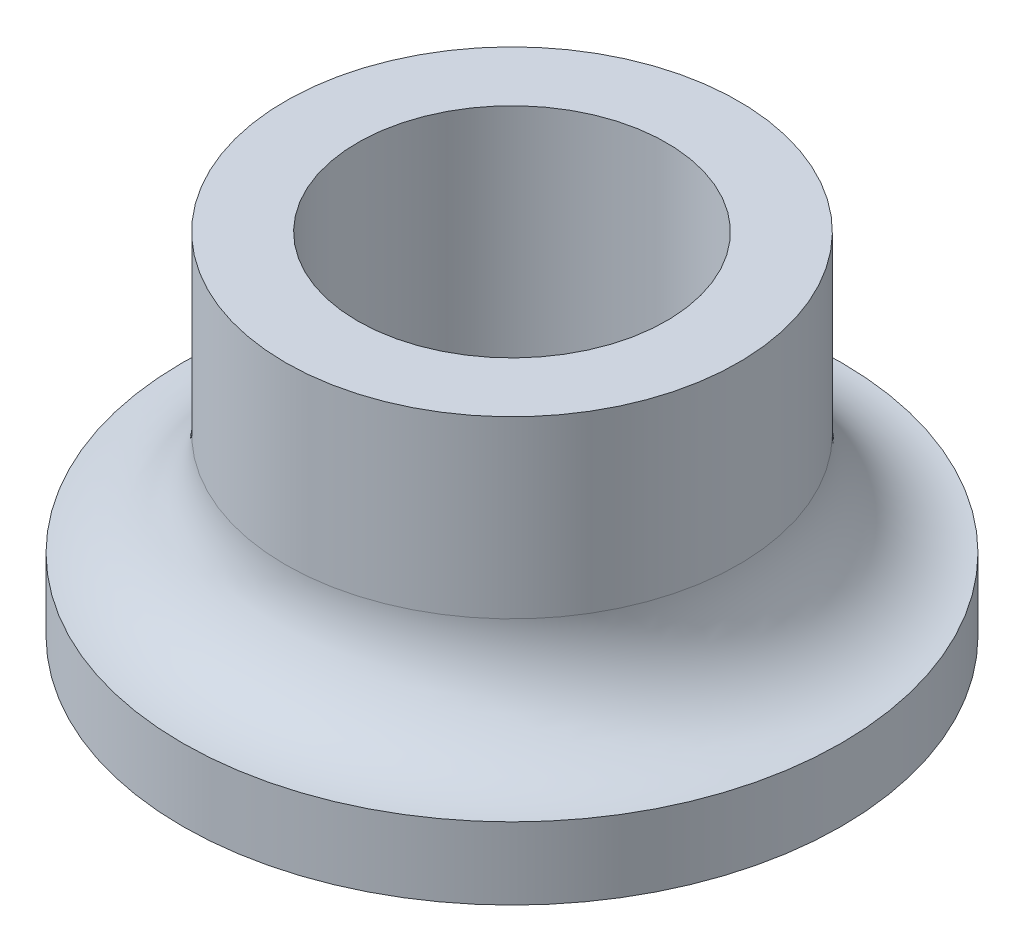
from build123d import *

# Parameters (mm, degrees)
SKETCH_1_R      = 16
SKETCH_1_R_2    = 7.5
EXTRUDE_1_DEPTH = 3.5
SKETCH_2_R      = 11
SKETCH_2_R_2    = 7.5
EXTRUDE_2_DEPTH = 13.5
FILLET_1_R      = 5


with BuildPart() as part:
    # 草圖1 → 填料-伸長1 (new body)
    with BuildSketch(Plane(origin=(0, 0, 0), x_dir=(1, 0, 0), z_dir=(0, 1, 0))):
        with Locations(Location((0, 0, 0), (0, 0, 270))):
            Circle(SKETCH_1_R)
        with Locations(Location((0, 0, 0), (0, 0, 270))):
            Circle(SKETCH_1_R_2, mode=Mode.SUBTRACT)
    extrude(amount=EXTRUDE_1_DEPTH)

    # 草圖2 → 填料-伸長2 (add)
    with BuildSketch(Plane(origin=(0, 3.5, 0), x_dir=(1, 0, 0), z_dir=(0, 1, 0))):
        with Locations(Location((0, 0, 0), (0, 0, 270))):
            Circle(SKETCH_2_R)
        with Locations(Location((0, 0, 0), (0, 0, 270))):
            Circle(SKETCH_2_R_2, mode=Mode.SUBTRACT)
    extrude(amount=EXTRUDE_2_DEPTH)

    # 圓角1
    fillet_1_edges = [part.edges().sort_by_distance(p)[0] for p in [
        (0, 3.5, -11),
    ]]
    fillet(fillet_1_edges, radius=FILLET_1_R - 0.0001)  # a hair under: the kernel refuses the full size


solid = part.part
